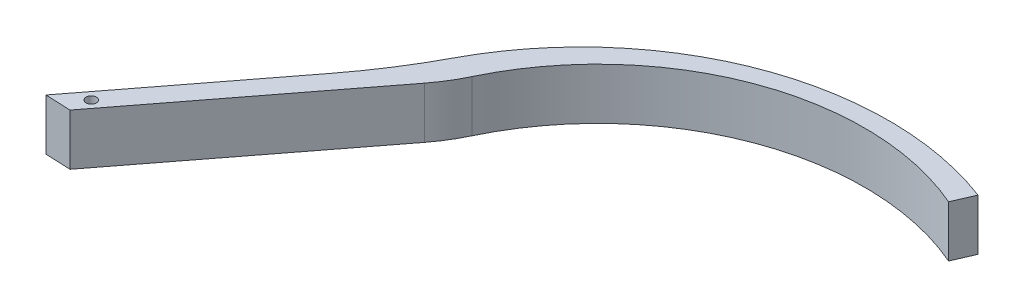
from build123d import *

# Parameters (mm, degrees)
SKETCH1_R           = 0.635
BOSS_EXTRUDE2_DEPTH = 6.35
FILLET3_R           = 20.32
FILLET4_R           = 66.04


with BuildPart() as part:
    # Sketch1 → Boss-Extrude2 (new body)
    with BuildSketch(Plane(origin=(0, 0, 0), x_dir=(1, 0, 0), z_dir=(0, 1, 0))):
        with BuildLine():
            Line((47.794805193, 18.995421593), (48.893920759, 21.535421593))
            ThreePointArc((48.893920759, 21.535421593), (20.039783642, 20.773744309), (0, 0))
            Line((0, 0), (-19.495514485, -25.4))
            Line((-19.495514485, -25.4), (-16.395019187, -25.532154609))
            Line((-16.395019187, -25.532154609), (4.121980582, 1.198701585))
            ThreePointArc((4.121980582, 1.198701585), (22.220591803, 19.269556921), (47.794805193, 18.995421593))
        make_face()
        with Locations((-16.158693694, -23.139871814)):
            Circle(SKETCH1_R, mode=Mode.SUBTRACT)
    extrude(amount=BOSS_EXTRUDE2_DEPTH)

    # Fillet3
    fillet3_edges = [part.edges().sort_by_distance(p)[0] for p in [
        (4.121980582, 3.175, -1.198701585),
    ]]
    fillet(fillet3_edges, radius=FILLET3_R)

    # Fillet4
    fillet4_edges = [part.edges().sort_by_distance(p)[0] for p in [
        (0, 3.175, 0),
    ]]
    fillet(fillet4_edges, radius=FILLET4_R)


solid = part.part
